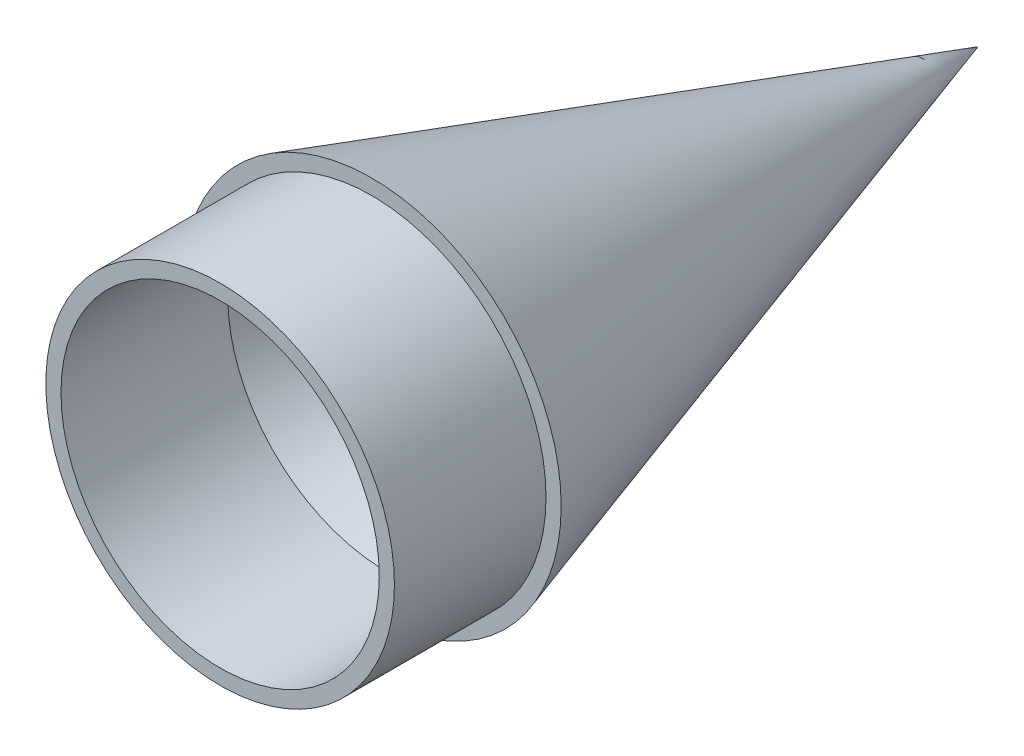
from build123d import *

# Parameters (mm, degrees)
SHELL_1_T = -2


with BuildPart() as part:
    # Эскиз1 → Повернуть1 (revolve)
    with BuildSketch(Plane(origin=(0, 0, 0), x_dir=(1, 0, 0), z_dir=(0, 1, 0))):
        Polygon((0, 80), (-25, 0), (-23, 0), (-23, -20), (-21.743663556, -20), (0, -20), align=None)
    revolve(axis=Axis((0, 0, 20), (0, 0, -1)))

    # Оболочка1
    shell_1_openings = [part.faces().sort_by_distance(p)[0] for p in [
        (0, 0, 20),
    ]]
    offset(amount=SHELL_1_T, openings=shell_1_openings, kind=Kind.INTERSECTION)


solid = part.part
